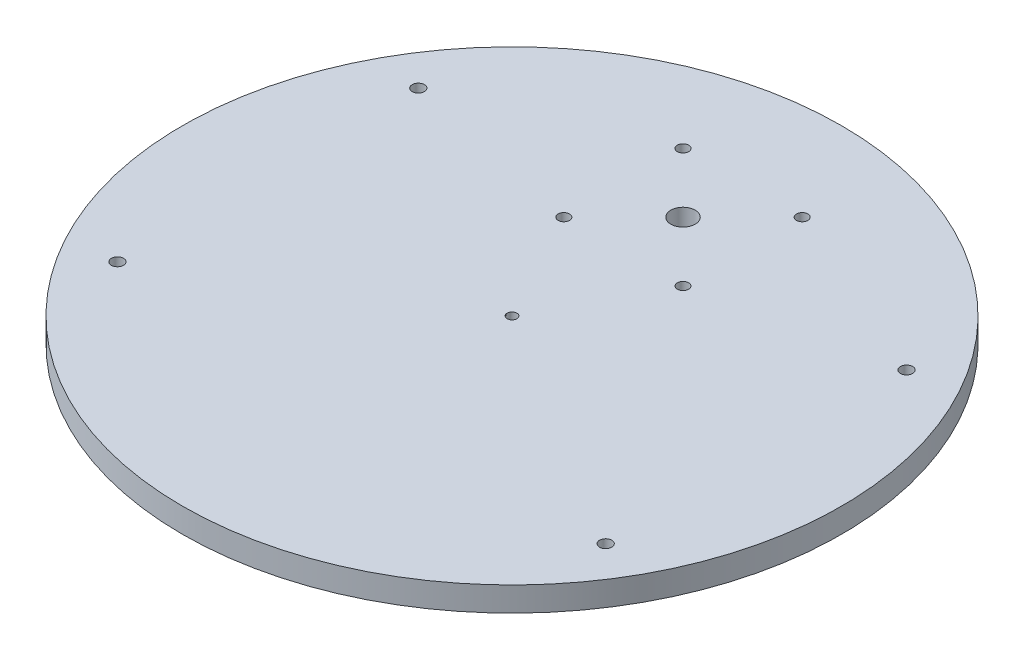
from build123d import *

# Parameters (mm, degrees)
SKETCH1_R           = 85.725
BOSS_EXTRUDE1_DEPTH = 6.35
CUT_EXTRUDE1_REACH  = 123.4
SKETCH2_R           = 1.5875
CUT_EXTRUDE2_REACH  = 123.4
SKETCH3_R           = 3.175
CUT_EXTRUDE3_REACH  = 123.4
SKETCH5_R           = 1.4732
CENTER_HOLE_REACH   = 123.4
SKETCH6_R           = 1.27


with BuildPart() as part:
    # Sketch1 → Boss-Extrude1 (new body)
    with BuildSketch(Plane(origin=(0, 0, 0), x_dir=(1, 0, 0), z_dir=(0, 1, 0))):
        Circle(SKETCH1_R)
    extrude(amount=BOSS_EXTRUDE1_DEPTH)

    # Sketch2 → Cut-Extrude1 (cut, up to next)
    with BuildSketch(Plane(origin=(0, 6.35, 0), x_dir=(1, 0, 0), z_dir=(0, 1, 0)), mode=Mode.PRIVATE) as cut_extrude1_sk1:
        with Locations((-63.5, 39.13251)):
            Circle(SKETCH2_R)
    cut_extrude1_tool1 = extrude(cut_extrude1_sk1.sketch, amount=-CUT_EXTRUDE1_REACH, mode=Mode.PRIVATE) & part.part
    # Sketch2 → Cut-Extrude1 (cut, up to next)
    with BuildSketch(Plane(origin=(0, 6.35, 0), x_dir=(1, 0, 0), z_dir=(0, 1, 0)), mode=Mode.PRIVATE) as cut_extrude1_sk2:
        with Locations((63.5, 39.13251)):
            Circle(SKETCH2_R)
    cut_extrude1_tool2 = extrude(cut_extrude1_sk2.sketch, amount=-CUT_EXTRUDE1_REACH, mode=Mode.PRIVATE) & part.part
    # Sketch2 → Cut-Extrude1 (cut, up to next)
    with BuildSketch(Plane(origin=(0, 6.35, 0), x_dir=(1, 0, 0), z_dir=(0, 1, 0)), mode=Mode.PRIVATE) as cut_extrude1_sk3:
        with Locations((-63.5, -39.13251)):
            Circle(SKETCH2_R)
    cut_extrude1_tool3 = extrude(cut_extrude1_sk3.sketch, amount=-CUT_EXTRUDE1_REACH, mode=Mode.PRIVATE) & part.part
    # Sketch2 → Cut-Extrude1 (cut, up to next)
    with BuildSketch(Plane(origin=(0, 6.35, 0), x_dir=(1, 0, 0), z_dir=(0, 1, 0)), mode=Mode.PRIVATE) as cut_extrude1_sk4:
        with Locations((63.5, -39.13251)):
            Circle(SKETCH2_R)
    cut_extrude1_tool4 = extrude(cut_extrude1_sk4.sketch, amount=-CUT_EXTRUDE1_REACH, mode=Mode.PRIVATE) & part.part
    add(cut_extrude1_tool1.solids().sort_by_distance((-63.5, 6.35, -39.13251))[0], mode=Mode.SUBTRACT)
    add(cut_extrude1_tool2.solids().sort_by_distance((63.5, 6.35, -39.13251))[0], mode=Mode.SUBTRACT)
    add(cut_extrude1_tool3.solids().sort_by_distance((-63.5, 6.35, 39.13251))[0], mode=Mode.SUBTRACT)
    add(cut_extrude1_tool4.solids().sort_by_distance((63.5, 6.35, 39.13251))[0], mode=Mode.SUBTRACT)

    # Sketch3 → Cut-Extrude2 (cut, up to next)
    with BuildSketch(Plane(origin=(0, 6.35, 0), x_dir=(1, 0, 0), z_dir=(0, 1, 0)), mode=Mode.PRIVATE) as cut_extrude2_sk1:
        with Locations((0, 44.482150941)):
            Circle(SKETCH3_R)
    cut_extrude2_tool1 = extrude(cut_extrude2_sk1.sketch, amount=-CUT_EXTRUDE2_REACH, mode=Mode.PRIVATE) & part.part
    add(cut_extrude2_tool1.solids().sort_by_distance((0, 6.35, -44.482151))[0], mode=Mode.SUBTRACT)

    # Sketch5 → Cut-Extrude3 (cut, up to next)
    with BuildSketch(Plane(origin=(0, 6.35, 0), x_dir=(1, 0, 0), z_dir=(0, 1, 0)), mode=Mode.PRIVATE) as cut_extrude3_sk1:
        with Locations((-15.50035, 59.982500941)):
            Circle(SKETCH5_R)
    cut_extrude3_tool1 = extrude(cut_extrude3_sk1.sketch, amount=-CUT_EXTRUDE3_REACH, mode=Mode.PRIVATE) & part.part
    # Sketch5 → Cut-Extrude3 (cut, up to next)
    with BuildSketch(Plane(origin=(0, 6.35, 0), x_dir=(1, 0, 0), z_dir=(0, 1, 0)), mode=Mode.PRIVATE) as cut_extrude3_sk2:
        with Locations((15.50035, 59.982500941)):
            Circle(SKETCH5_R)
    cut_extrude3_tool2 = extrude(cut_extrude3_sk2.sketch, amount=-CUT_EXTRUDE3_REACH, mode=Mode.PRIVATE) & part.part
    # Sketch5 → Cut-Extrude3 (cut, up to next)
    with BuildSketch(Plane(origin=(0, 6.35, 0), x_dir=(1, 0, 0), z_dir=(0, 1, 0)), mode=Mode.PRIVATE) as cut_extrude3_sk3:
        with Locations((-15.50035, 28.981800941)):
            Circle(SKETCH5_R)
    cut_extrude3_tool3 = extrude(cut_extrude3_sk3.sketch, amount=-CUT_EXTRUDE3_REACH, mode=Mode.PRIVATE) & part.part
    # Sketch5 → Cut-Extrude3 (cut, up to next)
    with BuildSketch(Plane(origin=(0, 6.35, 0), x_dir=(1, 0, 0), z_dir=(0, 1, 0)), mode=Mode.PRIVATE) as cut_extrude3_sk4:
        with Locations((15.50035, 28.981800941)):
            Circle(SKETCH5_R)
    cut_extrude3_tool4 = extrude(cut_extrude3_sk4.sketch, amount=-CUT_EXTRUDE3_REACH, mode=Mode.PRIVATE) & part.part
    add(cut_extrude3_tool1.solids().sort_by_distance((-15.50035, 6.35, -59.982501))[0], mode=Mode.SUBTRACT)
    add(cut_extrude3_tool2.solids().sort_by_distance((15.50035, 6.35, -59.982501))[0], mode=Mode.SUBTRACT)
    add(cut_extrude3_tool3.solids().sort_by_distance((-15.50035, 6.35, -28.981801))[0], mode=Mode.SUBTRACT)
    add(cut_extrude3_tool4.solids().sort_by_distance((15.50035, 6.35, -28.981801))[0], mode=Mode.SUBTRACT)

    # Sketch6 → center_hole (cut, up to next)
    with BuildSketch(Plane(origin=(0, 6.35, 0), x_dir=(1, 0, 0), z_dir=(0, 1, 0)), mode=Mode.PRIVATE) as center_hole_sk1:
        Circle(SKETCH6_R)
    center_hole_tool1 = extrude(center_hole_sk1.sketch, amount=-CENTER_HOLE_REACH, mode=Mode.PRIVATE) & part.part
    add(center_hole_tool1.solids().sort_by_distance((0, 6.35, 0))[0], mode=Mode.SUBTRACT)


solid = part.part
